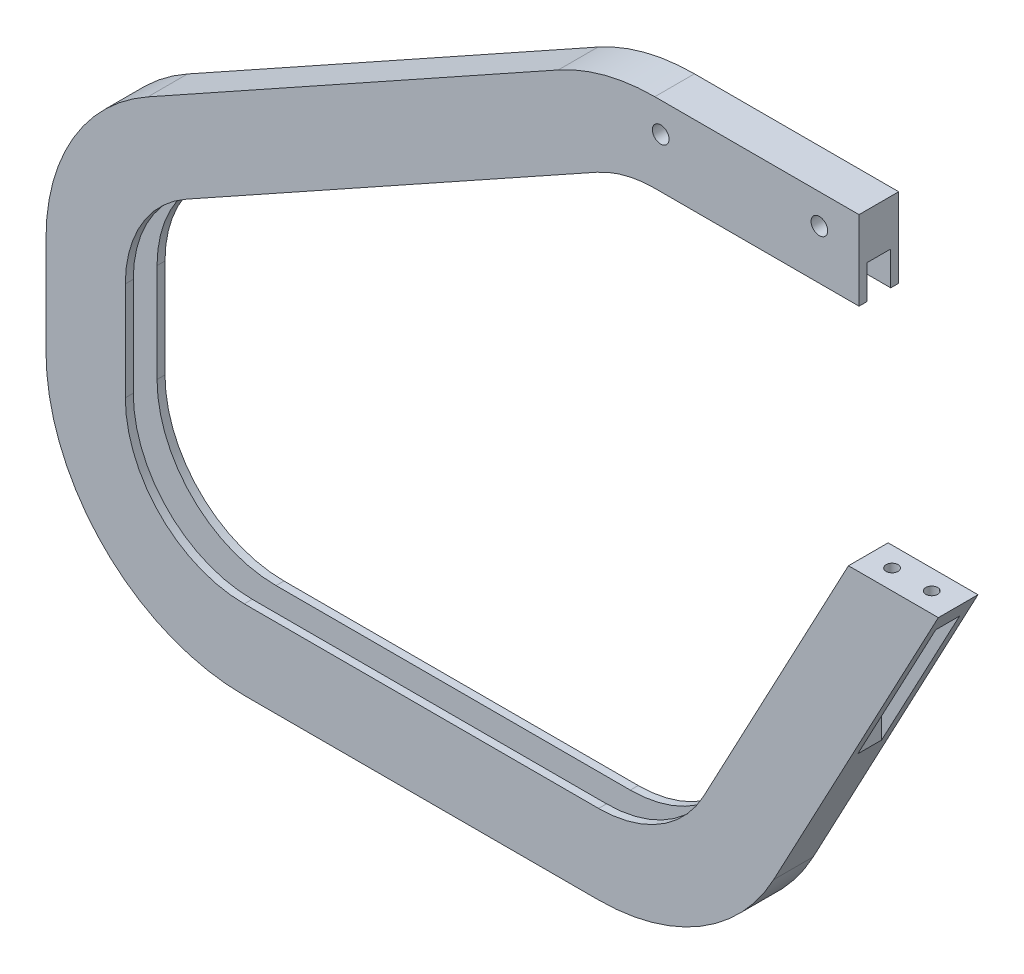
from build123d import *

# Parameters (mm, degrees)
SKETCH_1_R               = 2.1
EXTRUDE_1_DEPTH          = 10
CUT_EXTRUDE_1_DEPTH      = 3
CUT_EXTRUDE_1_DEPTH_BACK = 3
SKETCH_5_R               = 1.5
CUT_EXTRUDE_2_DEPTH      = 5


with BuildPart() as part:
    # 草图1 → 凸台-拉伸1 (new body)
    with BuildSketch(Plane.XY):
        with BuildLine():
            Line((-284.423734632, -77.499923245), (-232.930073268, -77.499923245))
            Line((-232.930073268, -77.499923245), (-232.930073268, -57.5))
            Line((-232.930073268, -57.5), (-284.423872481, -57.5))
            ThreePointArc((-284.423872481, -57.5), (-296.989028529, -59.104578177), (-308.747713571, -63.815325861))
            Line((-308.747713571, -63.815325861), (-412.253914359, -121.448086766))
            ThreePointArc((-412.253914359, -121.448086766), (-431.035711267, -139.796937003), (-437.930073268, -165.132760904))
            Line((-437.930073268, -165.132760904), (-437.930073268, -190))
            ThreePointArc((-437.930073268, -190), (-423.285412328, -225.355339059), (-387.930073268, -240))
            Line((-387.930073268, -240), (-298.601858772, -240))
            ThreePointArc((-298.601858772, -240), (-272.863892205, -232.866736253), (-254.469753791, -213.50228308))
            Line((-254.469753791, -213.50228308), (-212.930073268, -135.499923245))
            Line((-212.930073268, -135.499923245), (-235.589314209, -135.499923245))
            Line((-235.589314209, -135.499923245), (-272.122595783, -204.101369848))
            ThreePointArc((-272.122595783, -204.101369848), (-283.159078832, -215.720041752), (-298.601858772, -220))
            Line((-298.601858772, -220), (-387.930073268, -220))
            ThreePointArc((-387.930073268, -220), (-409.143276704, -211.213203436), (-417.930073268, -190))
            Line((-417.930073268, -190), (-417.930073268, -165.132760904))
            ThreePointArc((-417.930073268, -165.132760904), (-413.793456067, -149.931266564), (-402.524377922, -138.921956421))
            Line((-402.524377922, -138.921956421), (-299.018039286, -81.289118762))
            ThreePointArc((-299.018039286, -81.289118762), (-291.962828261, -78.462670151), (-284.423734632, -77.499923245))
        make_face()
        with Locations((-282.930073268, -65)):
            Circle(SKETCH_1_R, mode=Mode.SUBTRACT)
        with Locations((-242.930073268, -65)):
            Circle(SKETCH_1_R, mode=Mode.SUBTRACT)
    extrude(amount=EXTRUDE_1_DEPTH)

    # 草图4 → 切除-拉伸1 (cut, two sides: drawn at the far end of the back side and taken through both)
    with BuildSketch(Plane.XY.offset(5).offset(-CUT_EXTRUDE_1_DEPTH_BACK)):
        with BuildLine():
            Line((-232.930073268, -69), (-296.097620095, -69))
            ThreePointArc((-296.097620095, -69), (-307.406260539, -70.444120359), (-317.989077076, -74.683793275))
            Line((-317.989077076, -74.683793275), (-409.82153025, -125.81655418))
            ThreePointArc((-409.82153025, -125.81655418), (-426.725147467, -142.330519394), (-432.930073268, -165.132760904))
            Line((-432.930073268, -165.132760904), (-432.930073268, -189.741089764))
            ThreePointArc((-432.930073268, -189.741089764), (-419.749878422, -221.560894918), (-387.930073268, -234.741089764))
            Line((-387.930073268, -234.741089764), (-299.095954009, -234.741089764))
            ThreePointArc((-299.095954009, -234.741089764), (-275.931784098, -228.321152392), (-259.377059526, -210.893144536))
            Line((-259.377059526, -210.893144536), (-240.239731933, -174.957463413))
            Line((-240.239731933, -174.957463413), (-240.239731933, -144.232382236))
            Line((-240.239731933, -144.232382236), (-272.122595783, -204.101369848))
            ThreePointArc((-272.122595783, -204.101369848), (-283.159078832, -215.720041752), (-298.601858772, -220))
            Line((-298.601858772, -220), (-387.930073268, -220))
            ThreePointArc((-387.930073268, -220), (-409.143276704, -211.213203436), (-417.930073268, -190))
            Line((-417.930073268, -190), (-417.930073268, -165.132760904))
            ThreePointArc((-417.930073268, -165.132760904), (-413.793456067, -149.931266564), (-402.524377922, -138.921956421))
            Line((-402.524377922, -138.921956421), (-299.018039286, -81.289118762))
            ThreePointArc((-299.018039286, -81.289118762), (-291.962828261, -78.462670151), (-284.423734632, -77.499923245))
            Line((-284.423734632, -77.499923245), (-232.930073268, -77.499923245))
            Line((-232.930073268, -77.499923245), (-232.930073268, -69))
        make_face()
        Polygon((-230.589314209, -140.499923245), (-235.239731933, -140.499923245), (-235.239731933, -177.392542568), (-215.592792743, -140.499923245), align=None)
    extrude(amount=CUT_EXTRUDE_1_DEPTH + CUT_EXTRUDE_1_DEPTH_BACK, mode=Mode.SUBTRACT)

    # 草图5 → 切除-拉伸2 (cut)
    with BuildSketch(Plane.XZ.offset(140.499923245)):
        with Locations((-229.592792743, 5)):
            Circle(SKETCH_5_R)
        with Locations((-219.592792743, 5)):
            Circle(SKETCH_5_R)
    extrude(amount=-CUT_EXTRUDE_2_DEPTH, mode=Mode.SUBTRACT)


solid = part.part
